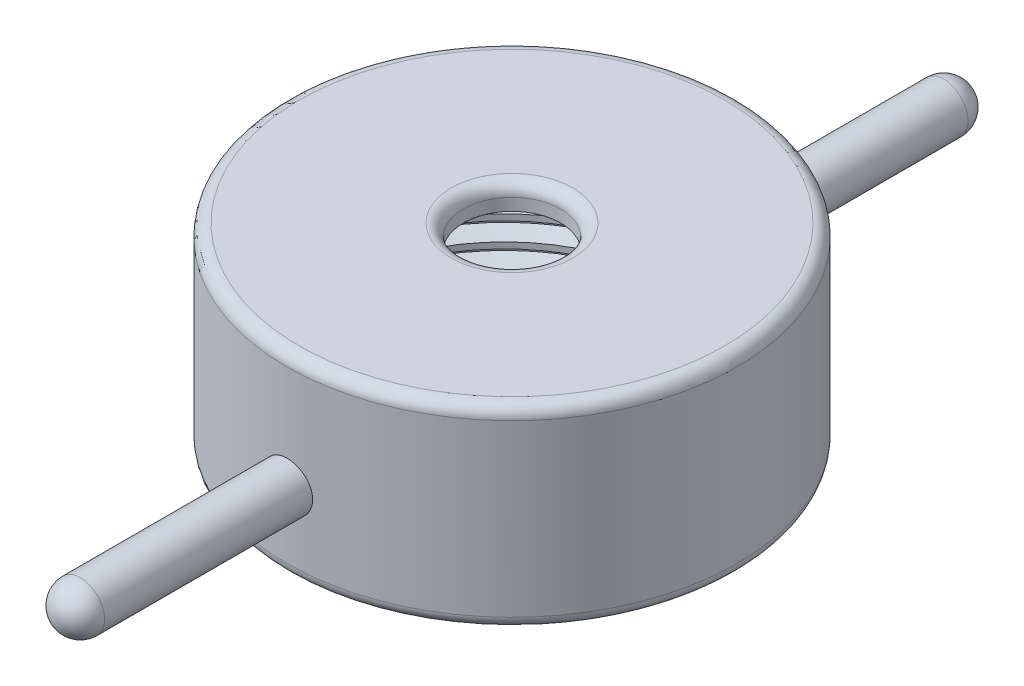
from build123d import *

# Parameters (mm, degrees)
FILLET1_R                = 2
BOSS_EXTRUDE1_REACH      = 124.217
BOSS_EXTRUDE1_END_RADIUS = 37
SKETCH2_R                = 4
THREAD1_PITCH            = 4
FILLET2_R                = 4


with BuildPart() as part:
    # Sketch1 → Revolve1 (revolve)
    with BuildSketch(Plane.XY, mode=Mode.PRIVATE) as revolve1_sk:
        Polygon((28, 0), (28, 30), (18, 30), (18, 28), (8, 28), (8, 32), (37, 32), (37, 0), align=None)
    revolve(revolve1_sk.sketch.rotate(Axis((0, 45.048489246, 0), (0, -1, 0)), 90), axis=Axis((0, 45.048489246, 0), (0, -1, 0)))

    # Fillet1
    fillet1_edges = [part.edges().sort_by_distance(p)[0] for p in [
        (0, 0, -37),
        (0, 32, -37),
        (0, 32, -8),
    ]]
    fillet(fillet1_edges, radius=FILLET1_R)

    # Boss-Extrude1: up to this cylinder (the profile starts outside it)
    boss_extrude1_end = Plane(origin=(0, 13, 0), z_dir=(0, 1, 0)) * Cylinder(BOSS_EXTRUDE1_END_RADIUS, 323.434, mode=Mode.PRIVATE)
    # Sketch2 → Boss-Extrude1 (add, up to the surface)
    with BuildSketch(Plane.XY.offset(75), mode=Mode.PRIVATE) as boss_extrude1_sk1:
        with Locations((0, 13)):
            Circle(SKETCH2_R)
    boss_extrude1_tool1 = extrude(boss_extrude1_sk1.sketch, amount=-BOSS_EXTRUDE1_REACH, mode=Mode.PRIVATE) - boss_extrude1_end
    boss_extrude1 = boss_extrude1_tool1.solids().sort_by_distance((0, 13, 75))[0]
    add(boss_extrude1)

    # Mirror1: Boss-Extrude1 across plane
    add(boss_extrude1.mirror(Plane.XY))

    # Thread1: the profile of Thread Profile1 profile screwed along a right-hand helix of 7 turns, 12 arcs to a turn; built about Z, then put on its axis
    thread1_z = Axis((0, 0, 0), (0, 0, 1))
    thread1_corners = [(27.9997, 0, -0.000173205), (30.1650635, 0, 1.249999995), (30.1650635, 0, 1.749999995), (27.9997, 0, 3.000173194)]
    with BuildLine(mode=Mode.PRIVATE) as thread1_profile:
        Line(thread1_corners[0], thread1_corners[1])
        Line(thread1_corners[1], thread1_corners[2])
        Line(thread1_corners[2], thread1_corners[3])
        Line(thread1_corners[3], thread1_corners[0])
    thread1_cap = Face(thread1_profile.wire())
    thread1_turn_angles = [0, 15, 30, 45, 60, 75, 90, 105, 120, 135, 150, 165, 180, 195, 210, 225, 240, 255, 270, 285, 300, 315, 330, 345, 360]
    thread1_turn_weights = [1, 0.9659258262890683, 1, 0.9659258262890683, 1, 0.9659258262890683, 1, 0.9659258262890683, 1, 0.9659258262890683, 1, 0.9659258262890683, 1, 0.9659258262890683, 1, 0.9659258262890683, 1, 0.9659258262890683, 1, 0.9659258262890683, 1, 0.9659258262890683, 1, 0.9659258262890683, 1]
    thread1_turn_rails = [Edge.make_bspline([Vector(p[0], p[1], 0).rotate(thread1_z, thread1_turn_angles[k]) / thread1_turn_weights[k] + Vector(0, 0, p[2] + THREAD1_PITCH * thread1_turn_angles[k] / 360) for k in range(25)], [0, 0, 0, 1, 1, 2, 2, 3, 3, 4, 4, 5, 5, 6, 6, 7, 7, 8, 8, 9, 9, 10, 10, 11, 11, 12, 12, 12], 2, thread1_turn_weights) for p in thread1_corners]
    thread1_turn_sides = [Face.make_surface_from_curves(thread1_turn_rails[p[0]], thread1_turn_rails[p[1]]) for p in [(0, 1), (1, 2), (2, 3), (3, 0)]]
    thread1 = Plane(origin=(0, 0, 0), x_dir=(1, 0, 0), z_dir=(0, 1, 0)) * Solid(Shell([*[p.moved(Location((0, 0, THREAD1_PITCH * i))) for i in range(7) for p in thread1_turn_sides], thread1_cap, thread1_cap.rotate(thread1_z, 2520).moved(Location((0, 0, THREAD1_PITCH * 2520 / 360)))]))
    add(thread1, mode=Mode.SUBTRACT)

    # Fillet2
    fillet2_edges = [part.edges().sort_by_distance(p)[0] for p in [
        (-4, 13, 75),
        (-4, 13, -75),
    ]]
    fillet(fillet2_edges, radius=FILLET2_R)


solid = part.part
